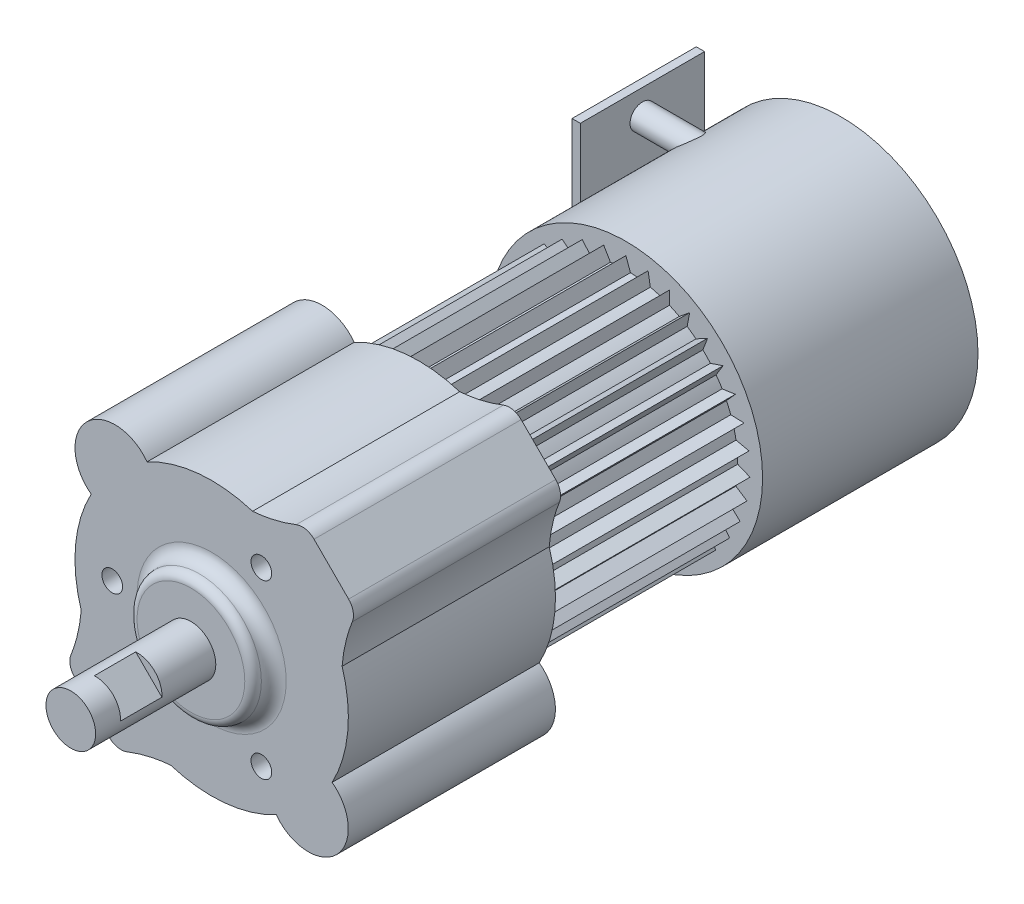
from build123d import *

# Parameters (mm, degrees)
BOSS_EXTRUDE1_DEPTH  = 25
FILLET1_R            = 2
BOSS_EXTRUDE2_DEPTH  = 25
BOSS_EXTRUDE5_START  = 26
SKETCH4_R            = 16.5
BOSS_EXTRUDE5_DEPTH  = 26
SKETCH6_W            = 1
SKETCH6_H            = 30.157972744
BOSS_EXTRUDE6_DEPTH  = 15
SKETCH7_R            = 1.5
BOSS_EXTRUDE9_DEPTH  = 15
SKETCH8_R            = 3
BOSS_EXTRUDE10_DEPTH = 17
SKETCH9_R            = 7.5
BOSS_EXTRUDE11_DEPTH = 2.5
FILLET2_R            = 1.5
FILLET3_R            = 1
SKETCH10_W           = 6
SKETCH10_H           = 5
CUT_EXTRUDE1_DEPTH   = 1
SKETCH12_R           = 1.25
CUT_EXTRUDE2_DEPTH   = 4


with BuildPart() as part:
    # Sketch1 → Boss-Extrude1 (new body)
    with BuildSketch(Plane.XY):
        with BuildLine():
            Line((11.392014277, 17.5), (17.5, 11.392014277))
            add(Edge.make_bspline(
                [(17.5, 11.392014277), (16.021001263, 8.336734414), (15.743328656, 4.93939296)],
                knots=[0, 0, 0, 1, 1, 1], degree=2))
            ThreePointArc((15.743328656, 4.93939296), (16.427227325, -1.547967187), (14.54349702, -7.793375035))
            ThreePointArc((14.54349702, -7.793375035), (15.078986372, -15.078986372), (7.793375035, -14.54349702))
            ThreePointArc((7.793375035, -14.54349702), (1.547967187, -16.427227325), (-4.93939296, -15.743328656))
            add(Edge.make_bspline(
                [(-11.392014277, -17.5), (-8.336734414, -16.021001263), (-4.93939296, -15.743328656)],
                knots=[0, 0, 0, 1, 1, 1], degree=2))
            Line((-11.392014277, -17.5), (-17.5, -11.392014277))
            add(Edge.make_bspline(
                [(-17.5, -11.392014277), (-16.021001263, -8.336734414), (-15.743328656, -4.93939296)],
                knots=[0, 0, 0, 1, 1, 1], degree=2))
            ThreePointArc((-15.743328656, -4.93939296), (-16.427227325, 1.547967187), (-14.54349702, 7.793375035))
            ThreePointArc((-14.54349702, 7.793375035), (-15.078986372, 15.078986372), (-7.793375035, 14.54349702))
            ThreePointArc((-7.793375035, 14.54349702), (-1.547967187, 16.427227325), (4.93939296, 15.743328656))
            add(Edge.make_bspline(
                [(11.392014277, 17.5), (8.336734414, 16.021001263), (4.93939296, 15.743328656)],
                knots=[0, 0, 0, 1, 1, 1], degree=2))
        make_face()
    extrude(amount=BOSS_EXTRUDE1_DEPTH)

    # Fillet1
    fillet1_edges = [part.edges().sort_by_distance(p)[0] for p in [
        (-11.392014277, -17.5, 12.5),
        (-17.5, -11.392014277, 12.5),
        (17.5, 11.392014277, 12.5),
        (11.392014277, 17.5, 12.5),
    ]]
    fillet(fillet1_edges, radius=FILLET1_R)

    # Sketch3 → Boss-Extrude2 (add)
    with BuildSketch(Plane(origin=(0, 0, 0), x_dir=(-1, 0, 0), z_dir=(0, 0, -1))):
        with BuildLine():
            Line((-0.551967724, 13.488711267), (0, 15))
            Line((0, 15), (0.551967724, 13.488711267))
            ThreePointArc((0.551967724, 13.488711267), (1.21013067, 13.445652969), (1.865405023, 13.37049977))
            Line((1.865405023, 13.37049977), (2.678353422, 14.758943829))
            Line((2.678353422, 14.758943829), (2.951599775, 13.173384484))
            ThreePointArc((2.951599775, 13.173384484), (3.591497415, 13.013498619), (4.222822117, 12.82254941))
            Line((4.222822117, 12.82254941), (5.270622361, 14.04352306))
            Line((5.270622361, 14.04352306), (5.256364979, 12.434654286))
            ThreePointArc((5.256364979, 12.434654286), (5.857430478, 12.163079717), (6.444514235, 11.862471761))
            Line((6.444514235, 11.862471761), (7.693489161, 12.876731904))
            Line((7.693489161, 12.876731904), (7.392186289, 11.296264067))
            ThreePointArc((7.392186289, 11.296264067), (7.935100906, 10.921729424), (8.459074362, 10.521124509))
            Line((8.459074362, 10.521124509), (9.869080889, 11.29607199))
            Line((9.869080889, 11.29607199), (9.290416649, 9.794802627))
            ThreePointArc((9.290416649, 9.794802627), (9.757730662, 9.329345761), (10.201752879, 8.841619659))
            Line((10.201752879, 8.841619659), (11.727472237, 9.352347028))
            Line((11.727472237, 9.352347028), (10.890045373, 7.978528171))
            ThreePointArc((10.890045373, 7.978528171), (11.266738925, 7.43710925), (11.616538664, 6.877937878))
            Line((11.616538664, 6.877937878), (13.208932978, 7.108029937))
            Line((13.208932978, 7.108029937), (12.139659079, 5.905817254))
            ThreePointArc((12.139659079, 5.905817254), (12.413624929, 5.305837927), (12.657959339, 4.693193515))
            Line((12.657959339, 4.693193515), (14.265847744, 4.635254916))
            Line((14.265847744, 4.635254916), (12.999094154, 3.643288512))
            ThreePointArc((12.999094154, 3.643288512), (13.161526814, 3.004032608), (13.292542786, 2.35760605))
            Line((13.292542786, 2.35760605), (14.864246427, 2.013498987))
            Line((14.864246427, 2.013498987), (13.440727646, 1.26366148))
            ThreePointArc((13.440727646, 1.26366148), (13.486406398, 0.60567521), (13.49989297, -0.053756813))
            Line((13.49989297, -0.053756813), (14.984895998, -0.672972455))
            Line((14.984895998, -0.672972455), (13.450365093, -1.156580672))
            ThreePointArc((13.450365093, -1.156580672), (13.377821784, -1.812149089), (13.273345487, -2.463391888))
            Line((13.273345487, -2.463391888), (14.623918683, -3.337814009))
            Line((14.623918683, -3.337814009), (13.02769674, -3.53964937))
            ThreePointArc((13.02769674, -3.53964937), (12.83926297, -4.171729424), (12.620181758, -4.79385152))
            Line((12.620181758, -4.79385152), (13.792916588, -5.895375475))
            Line((13.792916588, -5.895375475), (12.186307493, -5.808950825))
            ThreePointArc((12.186307493, -5.808950825), (11.88803968, -6.397226943), (11.561395003, -6.970232821))
            Line((11.561395003, -6.970232821), (12.518598806, -8.263454722))
            Line((12.518598806, -8.263454722), (10.953240297, -7.89154782))
            ThreePointArc((10.953240297, -7.89154782), (10.554725013, -8.417112325), (10.131015501, -8.922585103))
            Line((10.131015501, -8.922585103), (10.841922957, -10.365939735))
            Line((10.841922957, -10.365939735), (9.368126945, -9.720503975))
            ThreePointArc((9.368126945, -9.720503975), (8.8821728, -10.166464791), (8.375016824, -10.588158159))
            Line((8.375016824, -10.588158159), (8.816778784, -12.135254916))
            Line((8.816778784, -12.135254916), (7.481914285, -11.237035135))
            ThreePointArc((7.481914285, -11.237035135), (6.924140245, -11.589058714), (6.349838216, -11.913419099))
            Line((6.349838216, -11.913419099), (6.508256087, -13.514533019))
            Line((6.508256087, -13.514533019), (5.355226744, -12.392398739))
            ThreePointArc((5.355226744, -12.392398739), (4.743560125, -12.639170754), (4.120570583, -12.855772947))
            Line((4.120570583, -12.855772947), (3.990552684, -14.45944291))
            Line((3.990552684, -14.45944291), (3.056417809, -13.149460452))
            ThreePointArc((3.056417809, -13.149460452), (2.41051808, -13.283049446), (1.758864421, -13.384931675))
            Line((1.758864421, -13.384931675), (1.344589634, -14.93961441))
            Line((1.344589634, -14.93961441), (0.659373091, -13.483887686))
            ThreePointArc((0.659373091, -13.483887686), (0, -13.5), (-0.659373091, -13.483887686))
            Line((-0.659373091, -13.483887686), (-1.344589634, -14.93961441))
            Line((-1.344589634, -14.93961441), (-1.758864421, -13.384931675))
            ThreePointArc((-1.758864421, -13.384931675), (-2.41051808, -13.283049446), (-3.056417809, -13.149460452))
            Line((-3.056417809, -13.149460452), (-3.990552684, -14.45944291))
            Line((-3.990552684, -14.45944291), (-4.120570583, -12.855772947))
            ThreePointArc((-4.120570583, -12.855772947), (-4.743560125, -12.639170754), (-5.355226744, -12.392398739))
            Line((-5.355226744, -12.392398739), (-6.508256087, -13.514533019))
            Line((-6.508256087, -13.514533019), (-6.349838216, -11.913419099))
            ThreePointArc((-6.349838216, -11.913419099), (-6.924140245, -11.589058714), (-7.481914285, -11.237035135))
            Line((-7.481914285, -11.237035135), (-8.816778784, -12.135254916))
            Line((-8.816778784, -12.135254916), (-8.375016824, -10.588158159))
            ThreePointArc((-8.375016824, -10.588158159), (-8.8821728, -10.166464791), (-9.368126945, -9.720503975))
            Line((-9.368126945, -9.720503975), (-10.841922957, -10.365939735))
            Line((-10.841922957, -10.365939735), (-10.131015501, -8.922585103))
            ThreePointArc((-10.131015501, -8.922585103), (-10.554725013, -8.417112325), (-10.953240297, -7.89154782))
            Line((-10.953240297, -7.89154782), (-12.518598806, -8.263454722))
            Line((-12.518598806, -8.263454722), (-11.561395003, -6.970232821))
            ThreePointArc((-11.561395003, -6.970232821), (-11.88803968, -6.397226943), (-12.186307493, -5.808950825))
            Line((-12.186307493, -5.808950825), (-13.792916588, -5.895375475))
            Line((-13.792916588, -5.895375475), (-12.620181758, -4.79385152))
            ThreePointArc((-12.620181758, -4.79385152), (-12.83926297, -4.171729424), (-13.02769674, -3.53964937))
            Line((-13.02769674, -3.53964937), (-14.623918683, -3.337814009))
            Line((-14.623918683, -3.337814009), (-13.273345487, -2.463391888))
            ThreePointArc((-13.273345487, -2.463391888), (-13.377821784, -1.812149089), (-13.450365093, -1.156580672))
            Line((-13.450365093, -1.156580672), (-14.984895998, -0.672972455))
            Line((-14.984895998, -0.672972455), (-13.49989297, -0.053756813))
            ThreePointArc((-13.49989297, -0.053756813), (-13.486406398, 0.60567521), (-13.440727646, 1.26366148))
            Line((-13.440727646, 1.26366148), (-14.864246427, 2.013498987))
            Line((-14.864246427, 2.013498987), (-13.292542786, 2.35760605))
            ThreePointArc((-13.292542786, 2.35760605), (-13.161526814, 3.004032608), (-12.999094154, 3.643288512))
            Line((-12.999094154, 3.643288512), (-14.265847744, 4.635254916))
            Line((-14.265847744, 4.635254916), (-12.657959339, 4.693193515))
            ThreePointArc((-12.657959339, 4.693193515), (-12.413624929, 5.305837927), (-12.139659079, 5.905817254))
            Line((-12.139659079, 5.905817254), (-13.208932978, 7.108029937))
            Line((-13.208932978, 7.108029937), (-11.616538664, 6.877937878))
            ThreePointArc((-11.616538664, 6.877937878), (-11.266738925, 7.43710925), (-10.890045373, 7.978528171))
            Line((-10.890045373, 7.978528171), (-11.727472237, 9.352347028))
            Line((-11.727472237, 9.352347028), (-10.201752879, 8.841619659))
            ThreePointArc((-10.201752879, 8.841619659), (-9.757730662, 9.329345761), (-9.290416649, 9.794802627))
            Line((-9.290416649, 9.794802627), (-9.869080889, 11.29607199))
            Line((-9.869080889, 11.29607199), (-8.459074362, 10.521124509))
            ThreePointArc((-8.459074362, 10.521124509), (-7.935100906, 10.921729424), (-7.392186289, 11.296264067))
            Line((-7.392186289, 11.296264067), (-7.693489161, 12.876731904))
            Line((-7.693489161, 12.876731904), (-6.444514235, 11.862471761))
            ThreePointArc((-6.444514235, 11.862471761), (-5.857430478, 12.163079717), (-5.256364979, 12.434654286))
            Line((-5.256364979, 12.434654286), (-5.270622361, 14.04352306))
            Line((-5.270622361, 14.04352306), (-4.222822117, 12.82254941))
            ThreePointArc((-4.222822117, 12.82254941), (-3.591497415, 13.013498619), (-2.951599775, 13.173384484))
            Line((-2.951599775, 13.173384484), (-2.678353422, 14.758943829))
            Line((-2.678353422, 14.758943829), (-1.865405023, 13.37049977))
            ThreePointArc((-1.865405023, 13.37049977), (-1.21013067, 13.445652969), (-0.551967724, 13.488711267))
        make_face()
    extrude(amount=BOSS_EXTRUDE2_DEPTH)

    # Sketch4 → Boss-Extrude5 (add)
    with BuildSketch(Plane(origin=(0, 0, -25), x_dir=(-1, 0, 0), z_dir=(0, 0, -1)).offset(BOSS_EXTRUDE5_START)):
        with Locations(Location((0, 0, 0), (0, 0, 180))):
            Circle(SKETCH4_R)
    extrude(amount=-BOSS_EXTRUDE5_DEPTH)

    # Sketch8 → Boss-Extrude10 (add)
    with BuildSketch(Plane.XY.offset(25)):
        Circle(SKETCH8_R)
    extrude(amount=BOSS_EXTRUDE10_DEPTH)

    # Sketch9 → Boss-Extrude11 (add)
    with BuildSketch(Plane.XY.offset(25)):
        Circle(SKETCH9_R)
    extrude(amount=BOSS_EXTRUDE11_DEPTH)

    # Fillet2
    fillet2_edges = [part.edges().sort_by_distance(p)[0] for p in [
        (-7.5, 0, 25),
    ]]
    fillet(fillet2_edges, radius=FILLET2_R)

    # Fillet3
    fillet3_edges = [part.edges().sort_by_distance(p)[0] for p in [
        (-7.5, 0, 27.5),
    ]]
    fillet(fillet3_edges, radius=FILLET3_R - 0.0001)  # a hair under: the kernel refuses the full size

    # Sketch10 → Cut-Extrude1 (cut)
    with BuildSketch(Plane(origin=(2.121320344, 2.121320344, 0), x_dir=(0.707106781186556, -0.707106781186539, 0), z_dir=(0.707106781186539, 0.707106781186556, 0))):
        with Locations((0, -36.5)):
            Rectangle(SKETCH10_W, SKETCH10_H)
    extrude(amount=-CUT_EXTRUDE1_DEPTH, mode=Mode.SUBTRACT)

    # Sketch12 → Cut-Extrude2 (cut)
    with BuildSketch(Plane.XY.offset(25)):
        with Locations((-12, 0)):
            Circle(SKETCH12_R)
        with Locations((6, 10.392304845)):
            Circle(SKETCH12_R)
        with Locations((6, -10.392304845)):
            Circle(SKETCH12_R)
    extrude(amount=-CUT_EXTRUDE2_DEPTH, mode=Mode.SUBTRACT)


with BuildPart() as body_2:
    # Sketch6 → Boss-Extrude6 (new body)
    with BuildSketch(Plane(origin=(0, 0, -51), x_dir=(-1, 0, 0), z_dir=(0, 0, -1))):
        with Locations((17, 0)):
            Rectangle(SKETCH6_W, SKETCH6_H)
    extrude(amount=-BOSS_EXTRUDE6_DEPTH)

    # Sketch7 → Boss-Extrude9 (add)
    with BuildSketch(Plane.ZY.offset(17.5)):
        with Locations((-43.5, 12.066195749)):
            Circle(SKETCH7_R)
        with Locations(Location((-43.5, -12.066195749, 0), (0, 0, 180))):
            Circle(SKETCH7_R)
    extrude(amount=-BOSS_EXTRUDE9_DEPTH)


solid = Compound([part.part, body_2.part])
